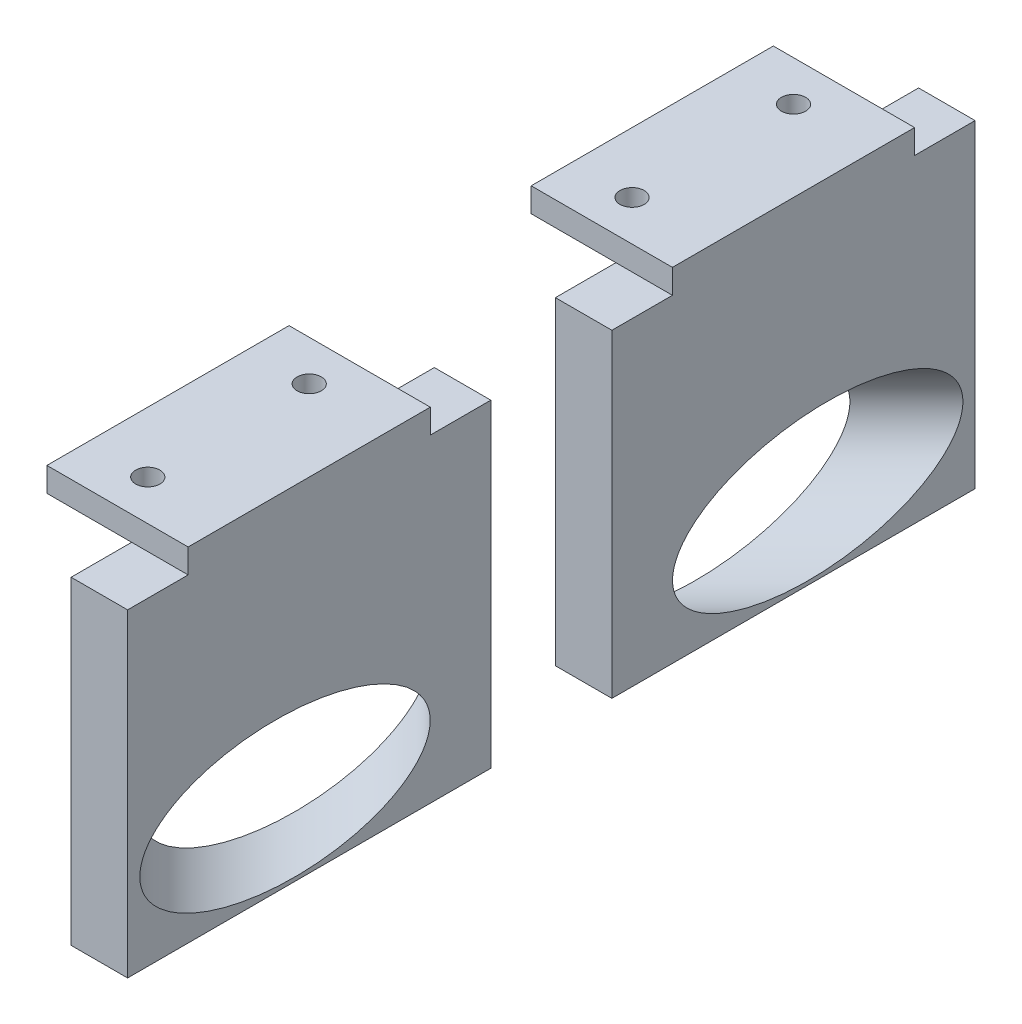
from build123d import *

# Parameters (mm, degrees)
EXTRUDE_1_DEPTH      = 5
EXTRUDE_1_DEPTH_BACK = 2
SKETCH_3_W           = 17.5
SKETCH_3_H           = 30
EXTRUDE_2_DEPTH      = 3
SKETCH_6_R           = 1.5
CUT_EXTRUDE_2_DEPTH  = 3
CUT_EXTRUDE_START    = -17.324116139
CUT_EXTRUDE_3_DEPTH  = 35.699555473


with BuildPart() as part:
    # 草图1 → 凸台-拉伸1 (new, two sides: drawn at the far end of the back side and taken through both)
    with BuildSketch(Plane(origin=(0, 0, 0), x_dir=(0, 0, -1), z_dir=(1, 0, 0)).offset(-EXTRUDE_1_DEPTH_BACK)):
        Polygon((-20, 11), (20, 11), (22.5, 11), (22.5, -28.5), (20, -28.5), (-20, -28.5), (-22.5, -28.5), (-22.5, 11), align=None)
    extrude(amount=EXTRUDE_1_DEPTH + EXTRUDE_1_DEPTH_BACK)

    # 草图3 → 凸台-拉伸2 (add)
    with BuildSketch(Plane(origin=(0, 11, 0), x_dir=(1, 0, 0), z_dir=(0, 1, 0))):
        with Locations((-3.75, 0)):
            Rectangle(SKETCH_3_W, SKETCH_3_H)
    extrude(amount=EXTRUDE_2_DEPTH)

    # 草图6 → 切除-拉伸2 (cut)
    with BuildSketch(Plane(origin=(0, 14, 0), x_dir=(1, 0, 0), z_dir=(0, 1, 0))):
        with Locations(Location((-5, 10, 0), (0, 0, 270))):
            Circle(SKETCH_6_R)
        with Locations(Location((-5, -10, 0), (0, 0, 270))):
            Circle(SKETCH_6_R)
    extrude(amount=-CUT_EXTRUDE_2_DEPTH, mode=Mode.SUBTRACT)

    # 切除-拉伸3: read off the stored shape, not the designer's step
    # 切除-拉伸3 outline → 切除-拉伸3 (cut)
    with BuildSketch(Plane(origin=(0, 0, 0), x_dir=(0.7071067811865441, 0, -0.707106781186551), z_dir=(0.707106781186551, 0, 0.707106781186544)).offset(CUT_EXTRUDE_START)):
        with BuildLine():
            add(Edge.make_bspline(
                [(-11.301258495, -18.204047299), (-11.788677989, -33.777256489), (7.528239844, -27.184580945), (26.845157678, -20.591905402), (8.015659338, -11.611371755), (-10.813839001, -2.630838109), (-11.301258495, -18.204047299)],
                knots=[0, 0, 0, 2.094395102, 2.094395102, 4.188790205, 4.188790205, 6.283185307, 6.283185307, 6.283185307], degree=2, weights=[1, 0.5, 1, 0.5, 1, 0.5, 1]))
        make_face()
    extrude(amount=CUT_EXTRUDE_3_DEPTH, mode=Mode.SUBTRACT)


with BuildPart() as body_2:
    # 镜向1: mirrored copy
    add(part.part.mirror(Plane(origin=(0, 0, -30), x_dir=(1, 0, 0), z_dir=(0, 0, -1))))


solid = Compound([part.part, body_2.part])
